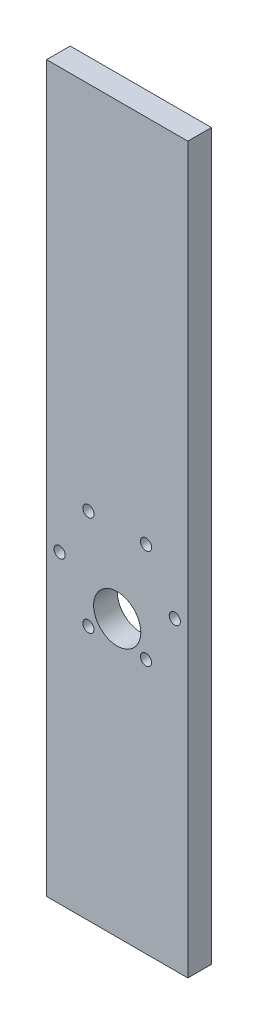
from build123d import *

# Parameters (mm, degrees)
CROQUIS1_W              = 38
CROQUIS1_H              = 150
SALIENTE_EXTRUIR1_DEPTH = 3.175
CROQUIS3_R              = 1.5
CROQUIS3_R_2            = 6.35
CORTAR_EXTRUIR2_DEPTH   = 25.4
CROQUIS8_W              = 38
CROQUIS8_H              = 6.35
SALIENTE_EXTRUIR2_DEPTH = 15
CROQUIS9_W              = 38
CROQUIS9_H              = 6.35
SALIENTE_EXTRUIR3_DEPTH = 30


with BuildPart() as part:
    # Croquis1 → Saliente-Extruir1 (new, symmetric)
    with BuildSketch(Plane.XY):
        Rectangle(CROQUIS1_W, CROQUIS1_H)
    extrude(amount=SALIENTE_EXTRUIR1_DEPTH, both=True)

    # Croquis3 → Cortar-Extruir2 (cut)
    with BuildSketch(Plane.XY.offset(3.175)):
        with Locations((-15.5, -23)):
            Circle(CROQUIS3_R)
        with Locations((-7.75, -9.576606241)):
            Circle(CROQUIS3_R)
        with Locations((7.75, -9.576606241)):
            Circle(CROQUIS3_R)
        with Locations((15.5, -23)):
            Circle(CROQUIS3_R)
        with Locations((7.75, -36.423393759)):
            Circle(CROQUIS3_R)
        with Locations((-7.75, -36.423393759)):
            Circle(CROQUIS3_R)
        with Locations((0, -30.8)):
            Circle(CROQUIS3_R_2)
    extrude(amount=-CORTAR_EXTRUIR2_DEPTH, mode=Mode.SUBTRACT)

    # Croquis8 → Saliente-Extruir2 (add)
    with BuildSketch(Plane(origin=(0, 75, 0), x_dir=(1, 0, 0), z_dir=(0, 1, 0))):
        Rectangle(CROQUIS8_W, CROQUIS8_H)
    extrude(amount=SALIENTE_EXTRUIR2_DEPTH)

    # Croquis9 → Saliente-Extruir3 (add)
    with BuildSketch(Plane.XZ.offset(75)):
        Rectangle(CROQUIS9_W, CROQUIS9_H)
    extrude(amount=SALIENTE_EXTRUIR3_DEPTH)


solid = part.part
